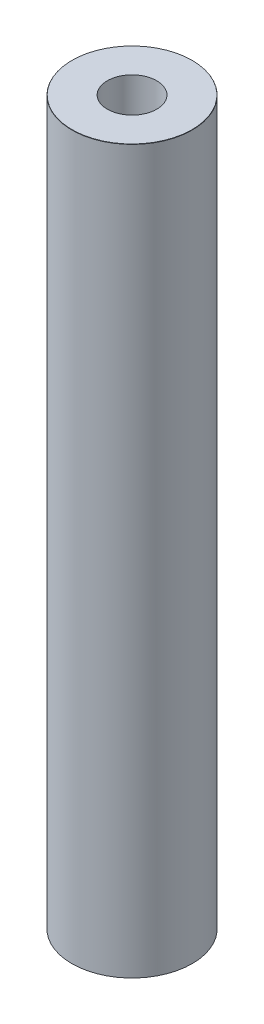
from build123d import *
from OCP.BRepFilletAPI import BRepFilletAPI_MakeChamfer

# Parameters (mm, degrees)
SKETCH1_R           = 50
BOSS_EXTRUDE1_DEPTH = 600
SKETCH2_R           = 20.517009312
CUT_EXTRUDE1_DEPTH  = 605.15229868
CHAMFER1_SIZE       = 0.223929209
CHAMFER1_SIZE2      = 0.124271344


with BuildPart() as part:
    # Sketch1 → Boss-Extrude1 (new body)
    with BuildSketch(Plane(origin=(0, 0, 0), x_dir=(1, 0, 0), z_dir=(0, 1, 0))):
        Circle(SKETCH1_R)
    extrude(amount=BOSS_EXTRUDE1_DEPTH)

    # Sketch2 → Cut-Extrude1 (cut, through all)
    with BuildSketch(Plane(origin=(0, 0, 0), x_dir=(1, 0, 0), z_dir=(0, 1, 0))):
        Circle(SKETCH2_R)
    extrude(amount=CUT_EXTRUDE1_DEPTH, mode=Mode.SUBTRACT)

    # Chamfer1: one chamfer whose edges measure the first distance from different faces: ONE call of the kernel's chamfer builder (chamfer() names one face for all edges)
    chamfer1_edges_1 = [part.edges().sort_by_distance(p)[0] for p in [
        (-50, 600, 0),
    ]]
    chamfer1_side_1 = [part.faces().sort_by_distance(p)[0] for p in [
        (-50, 300, 0),
    ]]
    chamfer1_edges_2 = [part.edges().sort_by_distance(p)[0] for p in [
        (-50, 0, 0),
    ]]
    chamfer1_side_2 = [part.faces().sort_by_distance(p)[0] for p in [
        (-48.585786438, 0, 0),
    ]]
    chamfer1 = BRepFilletAPI_MakeChamfer(part.part.solid().wrapped)
    for e in chamfer1_edges_1:
        chamfer1.Add(CHAMFER1_SIZE, CHAMFER1_SIZE2, e.wrapped, chamfer1_side_1[0].wrapped)  # the first distance lies on this face
    for e in chamfer1_edges_2:
        chamfer1.Add(CHAMFER1_SIZE, CHAMFER1_SIZE2, e.wrapped, chamfer1_side_2[0].wrapped)  # the first distance lies on this face
    add(Compound.cast(chamfer1.Shape()), mode=Mode.REPLACE)


solid = part.part
